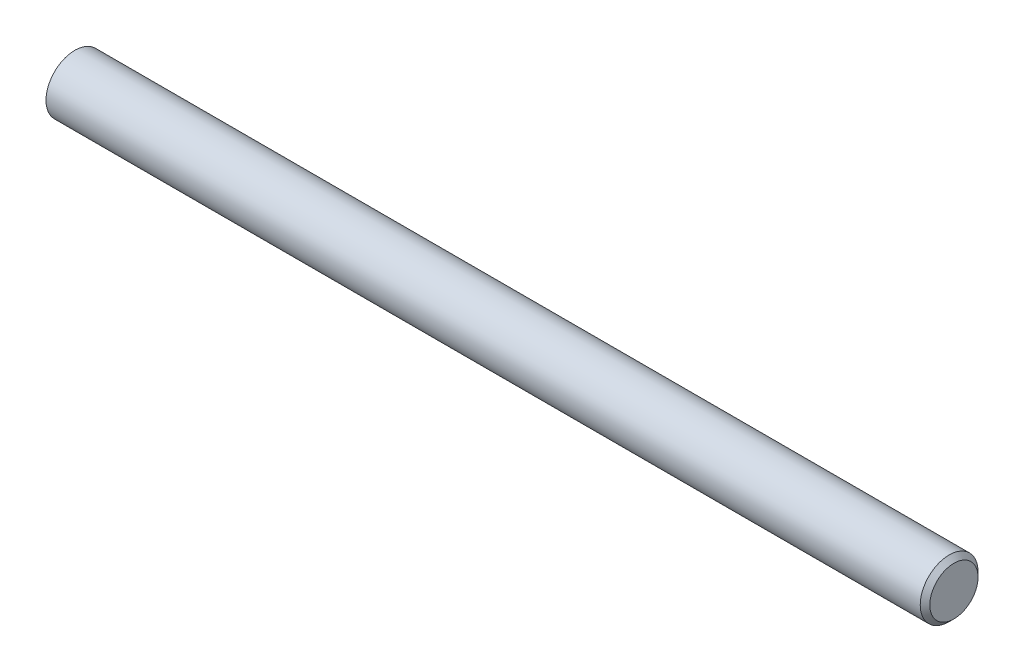
from build123d import *


with BuildPart() as part:
    # BodySke → Base-Revolve (revolve)
    with BuildSketch(Plane.XY):
        Polygon((0, 0), (0, 5), (151.172, 5), (152, 4.172), (152, 0), align=None)
    revolve(axis=Axis((-31.75, 0, 0), (1, 0, 0)))


solid = part.part
